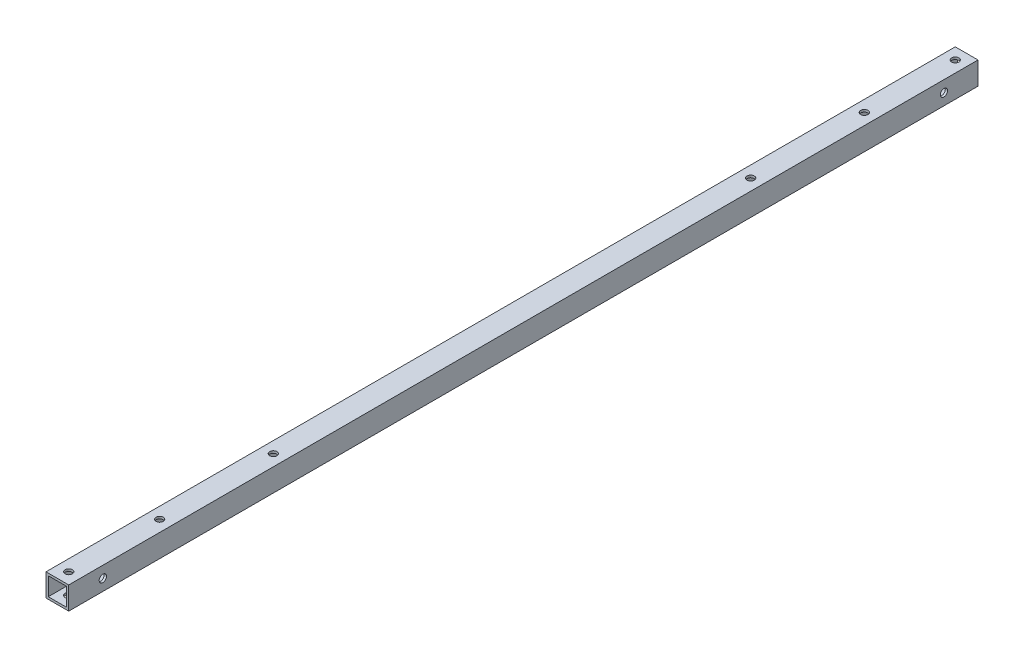
from build123d import *

# Parameters (mm, degrees)
EXTRUDE_1_OUTLINE_W   = 10
EXTRUDE_1_OUTLINE_H   = 10
EXTRUDE_1_OUTLINE_W_2 = 8
EXTRUDE_1_OUTLINE_H_2 = 8
EXTRUDE_1_DEPTH       = 400
SKETCH_2_R            = 1.6
CUT_EXTRUDE_1_DEPTH   = 401.156219494
SKETCH_3_R            = 1.6
CUT_EXTRUDE_2_DEPTH   = 401.156219494


# Read off the part's stored shape, not the designer's step: 押し出し-薄板1
with BuildPart() as part:
    # 押し出し-薄板1 outline → 押し出し-薄板1 (new body)
    with BuildSketch(Plane.XY):
        Rectangle(EXTRUDE_1_OUTLINE_W, EXTRUDE_1_OUTLINE_H)
        Rectangle(EXTRUDE_1_OUTLINE_W_2, EXTRUDE_1_OUTLINE_H_2, mode=Mode.SUBTRACT)
    extrude(amount=EXTRUDE_1_DEPTH)

    # ｽｹｯﾁ2 → ｶｯﾄ - 押し出し1 (cut, through all)
    with BuildSketch(Plane(origin=(0, 5, 0), x_dir=(1, 0, 0), z_dir=(0, 1, 0))):
        with Locations(Location((0, -355, 0), (0, 0, 270))):
            Circle(SKETCH_2_R)
        with Locations(Location((0, -45, 0), (0, 0, 270))):
            Circle(SKETCH_2_R)
        with Locations(Location((0, -305, 0), (0, 0, 270))):
            Circle(SKETCH_2_R)
        with Locations(Location((0, -95, 0), (0, 0, 270))):
            Circle(SKETCH_2_R)
        with Locations(Location((0, -395, 0), (0, 0, 270))):
            Circle(SKETCH_2_R)
        with Locations(Location((0, -5, 0), (0, 0, 270))):
            Circle(SKETCH_2_R)
    extrude(amount=-CUT_EXTRUDE_1_DEPTH, mode=Mode.SUBTRACT)

    # ｽｹｯﾁ3 → ｶｯﾄ - 押し出し2 (cut, through all)
    with BuildSketch(Plane(origin=(5, 0, 0), x_dir=(0, 0, -1), z_dir=(1, 0, 0))):
        with Locations((-385, 0)):
            Circle(SKETCH_3_R)
        with Locations((-15, 0)):
            Circle(SKETCH_3_R)
    extrude(amount=-CUT_EXTRUDE_2_DEPTH, mode=Mode.SUBTRACT)


solid = part.part
